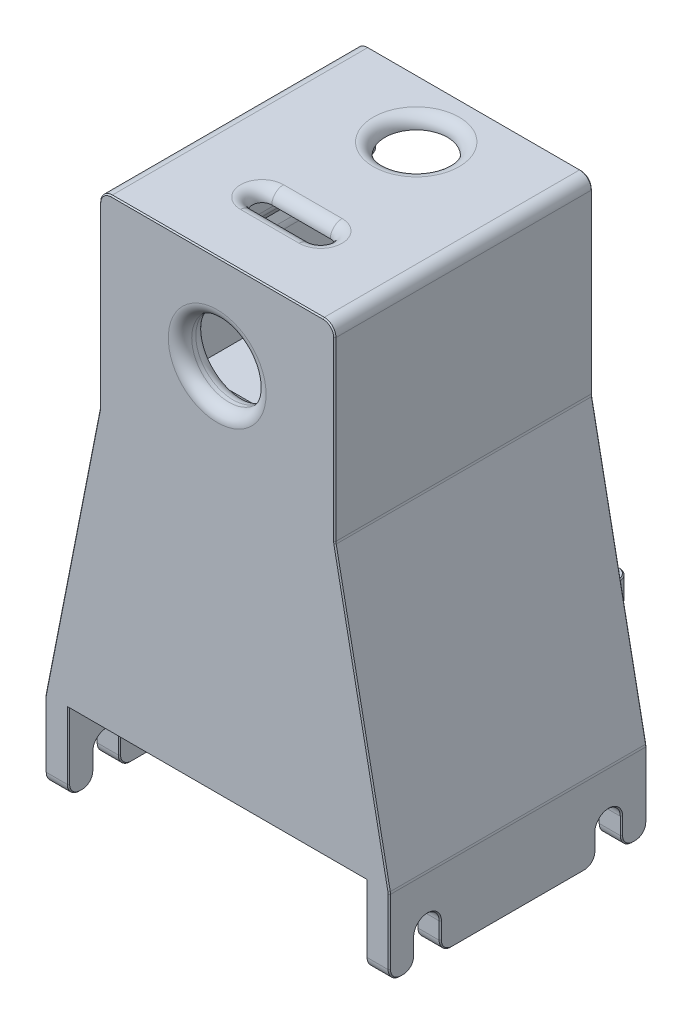
from build123d import *

# Parameters (mm, degrees)
TOP_SKETCH_R           = 9.525
LAMP_BASE_DEPTH        = 6
LAMP_BASE_BOSS_START   = -1.05
BASE_SKETCH_3_R        = 9.525
LAMP_BASE_BOSS_DEPTH   = 1.05
WALLS_DEPTH            = 60
UI_CUTOUT_REACH        = 84.828
UI_CUTOUT_SKETCH_R     = 8
VENT_CUTOUT_REACH      = 84.828
BOSS_EXTRUDE1_DEPTH    = 6
BOSS_EXTRUDE2_DEPTH    = 66
ALIGNMENT_TAB_START    = -96
SKETCH2_4_W            = 20
SKETCH2_4_H            = 6
ALIGNMENT_TAB_DEPTH    = 30
ALIGNMENT_PEG_SKETCH_R = 3.2639
ALIGNMENT_PEG_DEPTH    = 19.05
MOUNTING_SLOTS_DEPTH   = 171.604367028
LARGE_ROUNDOVER_R      = 3
CHAMFER1_SIZE          = 0.3


with BuildPart() as part:
    # top_sketch → lamp_base (new body)
    # profile 1 of 6: a face of its own
    with BuildSketch(Plane.XY):
        Polygon((-24.099390022, 21.25), (-30.13633469, 21.25), (-30.13633469, -21.25), (-24.13633469, -21.25), (-25.119364763, -2.492668817), (-26.63633469, 0), (-25.143724247, 2.507331183), align=None)
    # profile 2 of 6: a face of its own
    with BuildSketch(Plane.XY):
        Polygon((-30.13633469, 24.25), (-30.13633469, 21.25), (-24.099390022, 21.25), (24.099390022, 21.25), (30.13633469, 21.25), (30.13633469, 24.25), align=None)
    # profile 3 of 6: a face of its own
    with BuildSketch(Plane.XY):
        Polygon((24.099390022, 21.25), (-24.099390022, 21.25), (-25.143724247, 2.507331183), (-26.63633469, 0), (-25.119364763, -2.492668817), (-24.13633469, -21.25), (24.13633469, -21.25), (25.119364763, -2.492668817), (26.63633469, 0), (25.143724247, 2.507331183), align=None)
        with BuildLine():
            Line((-6.85, 13.65), (6.85, 13.65))
            ThreePointArc((6.85, 13.65), (13.921067812, 10.721067812), (16.85, 3.65))
            Line((16.85, 3.65), (16.85, -3.65))
            ThreePointArc((16.85, -3.65), (13.921067812, -10.721067812), (6.85, -13.65))
            Line((6.85, -13.65), (-6.85, -13.65))
            ThreePointArc((-6.85, -13.65), (-13.921067812, -10.721067812), (-16.85, -3.65))
            Line((-16.85, -3.65), (-16.85, 3.65))
            ThreePointArc((-16.85, 3.65), (-13.921067812, 10.721067812), (-6.85, 13.65))
        make_face(mode=Mode.SUBTRACT)
    # profile 4 of 6: a face of its own
    with BuildSketch(Plane.XY):
        Polygon((30.13633469, 21.25), (24.099390022, 21.25), (25.143724247, 2.507331183), (26.63633469, 0), (25.119364763, -2.492668817), (24.13633469, -21.25), (30.13633469, -21.25), align=None)
    # profile 5 of 6: a face of its own
    with BuildSketch(Plane.XY):
        Polygon((-24.13633469, -21.25), (-30.13633469, -21.25), (-30.13633469, -24.25), (30.13633469, -24.25), (30.13633469, -21.25), (24.13633469, -21.25), align=None)
    # profile 6 of 6: a face of its own
    with BuildSketch(Plane.XY):
        with BuildLine():
            Line((6.85, 13.65), (-6.85, 13.65))
            ThreePointArc((-6.85, 13.65), (-13.921067812, 10.721067812), (-16.85, 3.65))
            Line((-16.85, 3.65), (-16.85, -3.65))
            ThreePointArc((-16.85, -3.65), (-13.921067812, -10.721067812), (-6.85, -13.65))
            Line((-6.85, -13.65), (6.85, -13.65))
            ThreePointArc((6.85, -13.65), (13.921067812, -10.721067812), (16.85, -3.65))
            Line((16.85, -3.65), (16.85, 3.65))
            ThreePointArc((16.85, 3.65), (13.921067812, 10.721067812), (6.85, 13.65))
        make_face()
        Circle(TOP_SKETCH_R, mode=Mode.SUBTRACT)
    extrude(amount=LAMP_BASE_DEPTH)

    # base_sketch<3> → lamp_base_boss (add)
    with BuildSketch(Plane.XY.offset(LAMP_BASE_BOSS_START)):
        with BuildLine():
            ThreePointArc((16.85, 3.65), (13.921067812, 10.721067812), (6.85, 13.65))
            Line((6.85, 13.65), (-6.85, 13.65))
            ThreePointArc((-6.85, 13.65), (-13.921067812, 10.721067812), (-16.85, 3.65))
            Line((-16.85, 3.65), (-16.85, -3.65))
            ThreePointArc((-16.85, -3.65), (-13.921067812, -10.721067812), (-6.85, -13.65))
            Line((-6.85, -13.65), (6.85, -13.65))
            ThreePointArc((6.85, -13.65), (13.921067812, -10.721067812), (16.85, -3.65))
            Line((16.85, -3.65), (16.85, 3.65))
        make_face()
        with Locations(Location((0, 0, 0), (0, 0, 180))):
            Circle(BASE_SKETCH_3_R, mode=Mode.SUBTRACT)
    extrude(amount=LAMP_BASE_BOSS_DEPTH)

    # base_sketch<4> → walls (add)
    with BuildSketch(Plane.XY):
        Polygon((-24.099390022, 21.25), (-30.13633469, 21.25), (-30.13633469, -21.25), (-24.13633469, -21.25), (-25.119364763, -2.492668817), (-26.63633469, 0), (-25.143724247, 2.507331183), align=None)
        Polygon((-24.13633469, -21.25), (-30.13633469, -21.25), (-30.13633469, -24.25), (30.13633469, -24.25), (30.13633469, -21.25), (24.13633469, -21.25), align=None)
        Polygon((30.13633469, 21.25), (24.099390022, 21.25), (25.143724247, 2.507331183), (26.63633469, 0), (25.119364763, -2.492668817), (24.13633469, -21.25), (30.13633469, -21.25), align=None)
        Polygon((-30.13633469, 24.25), (-30.13633469, 21.25), (-24.099390022, 21.25), (24.099390022, 21.25), (30.13633469, 21.25), (30.13633469, 24.25), align=None)
    extrude(amount=-WALLS_DEPTH)

    # ui_cutout_sketch → ui_cutout (cut, up to next)
    with BuildSketch(Plane(origin=(0, 24.25, 0), x_dir=(1, 0, 0), z_dir=(0, 1, 0)), mode=Mode.PRIVATE) as ui_cutout_sk1:
        with Locations(Location((0, 45, 0), (0, 0, 270))):
            Circle(UI_CUTOUT_SKETCH_R)
    ui_cutout_tool1 = extrude(ui_cutout_sk1.sketch, amount=-UI_CUTOUT_REACH, mode=Mode.PRIVATE) & part.part
    # ui_cutout_sketch → ui_cutout (cut, up to next)
    with BuildSketch(Plane(origin=(0, 24.25, 0), x_dir=(1, 0, 0), z_dir=(0, 1, 0)), mode=Mode.PRIVATE) as ui_cutout_sk2:
        with BuildLine():
            Line((7.5, 10.5), (-7.5, 10.5))
            ThreePointArc((-7.5, 10.5), (-10, 13), (-7.5, 15.5))
            Line((-7.5, 15.5), (7.5, 15.5))
            ThreePointArc((7.5, 15.5), (10, 13), (7.5, 10.5))
        make_face()
    ui_cutout_tool2 = extrude(ui_cutout_sk2.sketch, amount=-UI_CUTOUT_REACH, mode=Mode.PRIVATE) & part.part
    add(ui_cutout_tool1.solids().sort_by_distance((0, 24.25, -45))[0], mode=Mode.SUBTRACT)
    add(ui_cutout_tool2.solids().sort_by_distance((0, 24.25, -13))[0], mode=Mode.SUBTRACT)

    # vent_cutout_sketch → vent_cutout (cut, up to next)
    with BuildSketch(Plane.XZ.offset(24.25), mode=Mode.PRIVATE) as vent_cutout_sk1:
        with BuildLine():
            Line((-14, -3.5), (14, -3.5))
            ThreePointArc((14, -3.5), (18, -7.5), (14, -11.5))
            Line((14, -11.5), (-14, -11.5))
            ThreePointArc((-14, -11.5), (-18, -7.5), (-14, -3.5))
        make_face()
    vent_cutout_tool1 = extrude(vent_cutout_sk1.sketch, amount=-VENT_CUTOUT_REACH, mode=Mode.PRIVATE) & part.part
    add(vent_cutout_tool1.solids().sort_by_distance((0, -24.25, -7.5))[0], mode=Mode.SUBTRACT)

    # base_sketch → Boss-Extrude1 (add)
    with BuildSketch(Plane.XY.offset(6)):
        Polygon((-44.1, -115.007), (-38.1, -115.007), (-38.1, -95.007), (38.1, -95.007), (38.1, -115.007), (44.1, -115.007), (44.1, -95.007), (30.13633469, -24.25), (-30.13633469, -24.25), (-44.1, -95.007), align=None)
    extrude(amount=-BOSS_EXTRUDE1_DEPTH)

    # Sketch2<3> → Boss-Extrude2 (add)
    with BuildSketch(Plane.XY.offset(6)):
        Polygon((-44.1, -115.007), (-38.1, -115.007), (-38.1, -95.007), (38.1, -95.007), (38.1, -115.007), (44.1, -115.007), (44.1, -95.007), (30.13633469, -24.25), (24.13633469, -24.25), (36.915919388, -89.007), (-36.915919388, -89.007), (-24.13633469, -24.25), (-30.13633469, -24.25), (-44.1, -95.007), align=None)
    extrude(amount=-BOSS_EXTRUDE2_DEPTH)

    # Sketch2<4> → alignment_tab (add)
    with BuildSketch(Plane.XY.offset(6).offset(ALIGNMENT_TAB_START)):
        with Locations((0, -92.007)):
            Rectangle(SKETCH2_4_W, SKETCH2_4_H)
    extrude(amount=ALIGNMENT_TAB_DEPTH)

    # alignment_peg_sketch → alignment_peg (add)
    with BuildSketch(Plane.XZ.offset(95.007)):
        with Locations(Location((0, -79.7, 0), (0, 0, 90))):
            Circle(ALIGNMENT_PEG_SKETCH_R)
    extrude(amount=ALIGNMENT_PEG_DEPTH)

    # mounting_slots_sketch → mounting_slots (cut, through all)
    with BuildSketch(Plane(origin=(44.1, 0, 0), x_dir=(0, 0, -1), z_dir=(1, 0, 0))):
        with BuildLine():
            Line((0.5278, -115.007), (0.5278, -107.707))
            ThreePointArc((0.5278, -107.707), (3.7917, -104.4431), (7.0556, -107.707))
            Line((7.0556, -107.707), (7.0556, -115.007))
            Line((7.0556, -115.007), (0.5278, -115.007))
        make_face()
        with BuildLine():
            Line((53.4722, -115.007), (53.4722, -107.707))
            ThreePointArc((53.4722, -107.707), (50.2083, -104.4431), (46.9444, -107.707))
            Line((46.9444, -107.707), (46.9444, -115.007))
            Line((46.9444, -115.007), (53.4722, -115.007))
        make_face()
    extrude(amount=-MOUNTING_SLOTS_DEPTH, mode=Mode.SUBTRACT)

    # large_roundover
    large_roundover_edges = [part.edges().sort_by_distance(p)[0] for p in [
        (-18, -24.25, -7.5),
        (0, -24.25, -11.5),
        (18, -24.25, -7.5),
        (0, -24.25, -3.5),
        (30.13633469, -24.25, -27),
        (-30.13633469, -24.25, -27),
        (-30.13633469, 24.25, -27),
        (44.1, -95.007, -27),
        (30.13633469, 24.25, -27),
        (-41.1, -115.007, 6),
        (-44.1, -95.007, -27),
        (41.1, -115.007, 6),
        (-30.526127039, -56.6285, 0),
        (0, -89.007, 0),
        (30.526127039, -56.6285, 0),
        (-41.1, -115.007, -60),
        (24.13633469, -24.25, -30),
        (36.915919388, -89.007, -30),
        (-36.915919388, -89.007, -30),
        (-24.13633469, -24.25, -30),
        (41.1, -115.007, -60),
        (-10, -92.007, -60),
        (10, -92.007, -90),
        (-10, -92.007, -90),
        (10, -92.007, -60),
        (41.1, -115.007, -7.0556),
        (41.1, -115.007, -0.5278),
        (-41.1, -115.007, -7.0556),
        (-41.1, -115.007, -0.5278),
        (9.525, 0, -1.05),
        (41.1, -115.007, -53.4722),
        (41.1, -115.007, -46.9444),
        (-41.1, -115.007, -53.4722),
        (-41.1, -115.007, -46.9444),
        (-9.525, 0, 6),
        (-25.119364763, -2.492668817, -30),
        (25.119364763, -2.492668817, -30),
        (25.143724247, 2.507331183, -30),
        (-25.143724247, 2.507331183, -30),
        (0, 24.25, -53),
        (10, 24.25, -13),
        (0, 24.25, -15.5),
        (-10, 24.25, -13),
        (0, 24.25, -10.5),
    ]]
    fillet(large_roundover_edges, radius=LARGE_ROUNDOVER_R - 0.0001)  # a hair under: the kernel refuses the full size

    # Chamfer1
    chamfer1_edges = [part.edges().sort_by_distance(p)[0] for p in [
        (0, -95.007, 6),
        (38.1, -103.50705, -60),
        (-25.54995, -95.007, -60),
        (-38.1, -103.50705, -60),
        (0, -114.057, -82.9639),
        (38.1, -109.85705, -0.5278),
        (-38.1, -109.85705, -0.5278),
        (38.1, -104.4431, -3.7917),
        (-38.1, -104.4431, -3.7917),
        (-44.1, -109.85705, -0.5278),
        (-44.1, -104.4431, -3.7917),
        (44.1, -104.4431, -3.7917),
        (44.1, -109.85705, -0.5278),
        (13.921067812, 10.721067812, -1.05),
        (16.85, 0, -1.05),
        (13.921067812, -10.721067812, -1.05),
        (0, -13.65, -1.05),
        (-13.921067812, -10.721067812, -1.05),
        (38.1, -104.4431, -50.2083),
        (-38.1, -104.4431, -50.2083),
        (-13.921067812, 10.721067812, -1.05),
        (38.1, -109.85705, -46.9444),
        (-38.1, -109.85705, -46.9444),
        (-44.1, -104.4431, -50.2083),
        (-44.1, -109.85705, -46.9444),
        (-16.85, 0, -1.05),
        (44.1, -104.4431, -50.2083),
        (44.1, -109.85705, -46.9444),
        (0, 13.65, -1.05),
        (0, -24.25, -60),
        (0, 24.25, -60),
        (0, 24.25, 6),
        (37.118167345, -59.6285, 6),
        (30.13633469, -1.353358504, 6),
        (-30.13633469, -1.353358504, 6),
        (-37.118167345, -59.6285, 6),
        (-44.1, -103.653641496, 6),
        (-38.1, -103.50705, 6),
        (38.1, -103.50705, 6),
        (44.1, -103.653641496, 6),
        (29.257684323, 23.371349633, 6),
        (-29.257684323, 23.371349633, 6),
        (-44.085775296, -95.008390193, 6),
        (44.085775296, -95.008390193, 6),
        (-38.1, -115.007, -56.7361),
        (-44.1, -115.007, -56.7361),
        (-38.1, -109.85705, -7.0556),
        (-38.1, -115.007, -27),
        (-38.1, -109.85705, -53.4722),
        (-38.1, -115.007, 2.7361),
        (-38.1, -114.128349633, 5.121349633),
        (-38.1, -114.128349633, 0.350850367),
        (-38.1, -114.128349633, -7.934250367),
        (-38.1, -114.128349633, -46.065749633),
        (-38.1, -114.128349633, -54.350850367),
        (-38.1, -114.128349633, -59.121349633),
        (-24.608041557, -12.249296797, -60),
        (24.608041557, -12.249296797, -60),
        (26.078316171, 0.937376018, -60),
        (24.601079012, 12.246186506, -60),
        (-24.601079012, 12.246186506, -60),
        (-26.078316171, 0.937376018, -60),
        (-44.1, -103.653641496, -60),
        (-37.118167345, -59.6285, -60),
        (-30.13633469, -1.353358504, -60),
        (30.13633469, -1.353358504, -60),
        (37.118167345, -59.6285, -60),
        (44.1, -103.653641496, -60),
        (-23.13302005, -89.007, -60),
        (30.411504406, -56.047681604, -60),
        (-30.411504406, -56.047681604, -60),
        (29.257684323, 23.371349633, -60),
        (-29.257684323, 23.371349633, -60),
        (25.2288551, 2.533321319, -60),
        (25.209206402, -2.520413781, -60),
        (-25.209206402, -2.520413781, -60),
        (-25.2288551, 2.533321319, -60),
        (-44.085775296, -95.008390193, -60),
        (44.085775296, -95.008390193, -60),
        (-44.1, -115.007, 2.7361),
        (-44.1, -109.85705, -53.4722),
        (-44.1, -115.007, -27),
        (-44.1, -109.85705, -7.0556),
        (-44.1, -114.128349633, 5.121349633),
        (-44.1, -114.128349633, 0.350850367),
        (-44.1, -114.128349633, -7.934250367),
        (-44.1, -114.128349633, -46.065749633),
        (-44.1, -114.128349633, -54.350850367),
        (-44.1, -114.128349633, -59.121349633),
        (44.1, -109.85705, -7.0556),
        (38.1, -109.85705, -7.0556),
        (44.1, -115.007, -27),
        (44.1, -109.85705, -53.4722),
        (44.1, -115.007, -56.7361),
        (44.1, -115.007, 2.7361),
        (44.1, -114.128349633, -46.065749633),
        (44.1, -114.128349633, -54.350850367),
        (44.1, -114.128349633, -59.121349633),
        (44.1, -114.128349633, 5.121349633),
        (44.1, -114.128349633, 0.350850367),
        (44.1, -114.128349633, -7.934250367),
        (38.1, -115.007, -27),
        (38.1, -115.007, 2.7361),
        (38.1, -115.007, -56.7361),
        (38.1, -109.85705, -53.4722),
        (38.1, -114.128349633, -46.065749633),
        (38.1, -114.128349633, -54.350850367),
        (38.1, -114.128349633, -59.121349633),
        (38.1, -114.128349633, 5.121349633),
        (38.1, -114.128349633, 0.350850367),
        (38.1, -114.128349633, -7.934250367),
        (0, -89.007, -90),
        (0, -95.007, -90),
        (10, -89.007, -75),
        (-10, -89.007, -75),
        (9.121349633, -89.007, -89.121349633),
        (-9.121349633, -89.007, -89.121349633),
        (-10, -95.007, -75),
        (10, -95.007, -75),
        (9.121349633, -95.007, -89.121349633),
        (-9.121349633, -95.007, -89.121349633),
        (-23.575459126, -24.932380085, -60),
        (-10.878650367, -89.007, -60.878650367),
        (-10.878650367, -95.007, -60.878650367),
        (23.575459126, -24.932380085, -60),
        (10.878650367, -89.007, -60.878650367),
        (10.878650367, -95.007, -60.878650367),
        (35.583660016, -87.911962581, -60),
        (-35.583660016, -87.911962581, -60),
        (-30.150559394, -24.248609807, -60),
        (-30.150559394, -24.248609807, 6),
        (30.150559394, -24.248609807, -60),
        (30.150559394, -24.248609807, 6),
        (26.074610779, -0.923018745, -60),
        (0, 21.25, -60),
        (-26.074610779, -0.923018745, -60),
        (0, -21.25, -60),
    ]]
    chamfer(chamfer1_edges, length=CHAMFER1_SIZE)


solid = part.part
